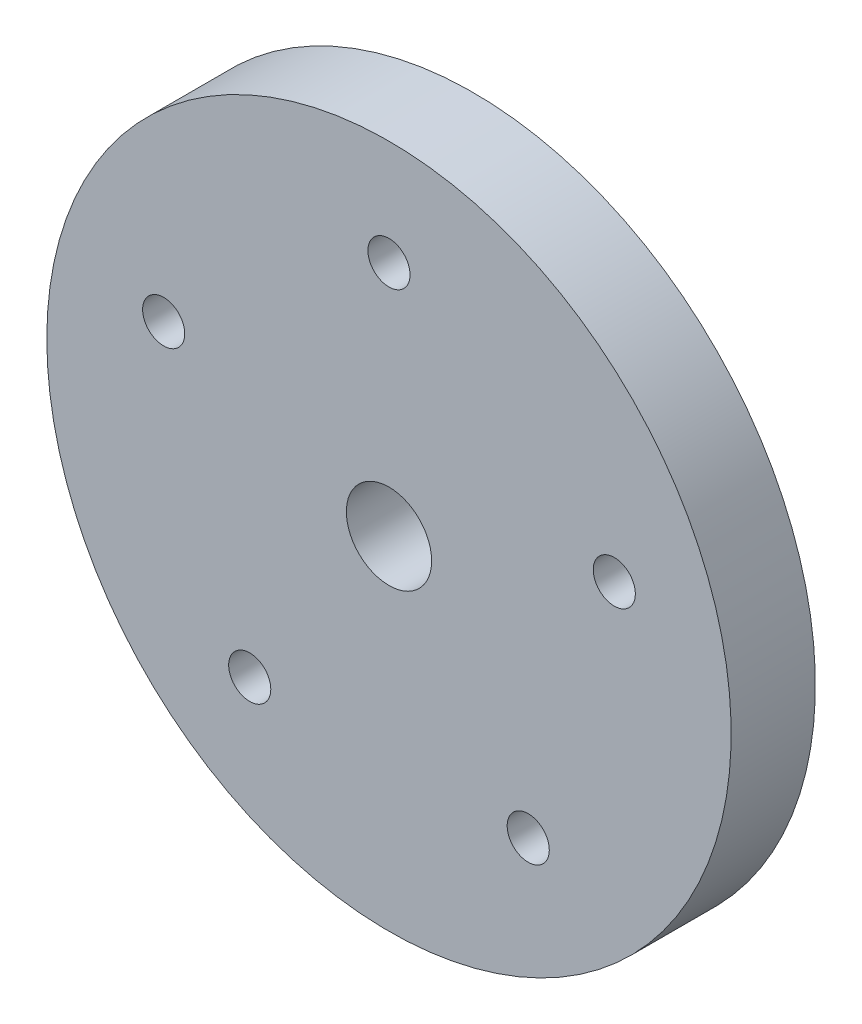
from build123d import *

# Parameters (mm, degrees)
F_4_0_4_HEAT_INSERT_M3_D         = 4
F_8_1_8_1_DURCHMESSER_BOHRUNG1_D = 8.1
SKIZZE8_R                        = 2
SCHNITT_LINEAR_AUSTRAGEN1_DEPTH  = 7
KREISMUSTER1_COUNT               = 5


with BuildPart() as part:
    # Skizze1 → Rotation1 (revolve)
    with BuildSketch(Plane(origin=(0, 0, 0), x_dir=(0, 0, -1), z_dir=(1, 0, 0))):
        Polygon((0, 0), (20, 0), (20, 15), (8, 15), (8, 32.5), (0, 32.5), align=None)
    revolve(axis=Axis((0, 0, 0), (0, 0, 1)))

    # Ø4.0 (4) Heat Insert M3 (through all)
    with Locations(Plane.XY):
        with Locations((0, 22.5)):
            f_4_0_4_heat_insert_m3 = Hole(F_4_0_4_HEAT_INSERT_M3_D / 2)

    # Ø8.1 (8.1) Durchmesser Bohrung1 (through all)
    with Locations(Plane.XY):
        with Locations((0, 0)):
            Hole(F_8_1_8_1_DURCHMESSER_BOHRUNG1_D / 2)

    # Skizze8 → Schnitt-Linear austragen1 (cut)
    with BuildSketch(Plane(origin=(0, 0, -20), x_dir=(-1, 0, 0), z_dir=(0, 0, -1))):
        with Locations((0, 10)):
            Circle(SKIZZE8_R)
        with Locations((8.660254038, -5)):
            Circle(SKIZZE8_R)
        with Locations((-8.660254038, -5)):
            Circle(SKIZZE8_R)
    extrude(amount=-SCHNITT_LINEAR_AUSTRAGEN1_DEPTH, mode=Mode.SUBTRACT)

    # Kreismuster1: Ø4.0 (4) Heat Insert M3 ×5 about axis
    kreismuster1_axis = Axis((0, 0, 0), (0, 0, -1))
    for i in range(1, KREISMUSTER1_COUNT):
        add(f_4_0_4_heat_insert_m3.rotate(kreismuster1_axis, i * 360 / KREISMUSTER1_COUNT), mode=Mode.SUBTRACT)


solid = part.part
